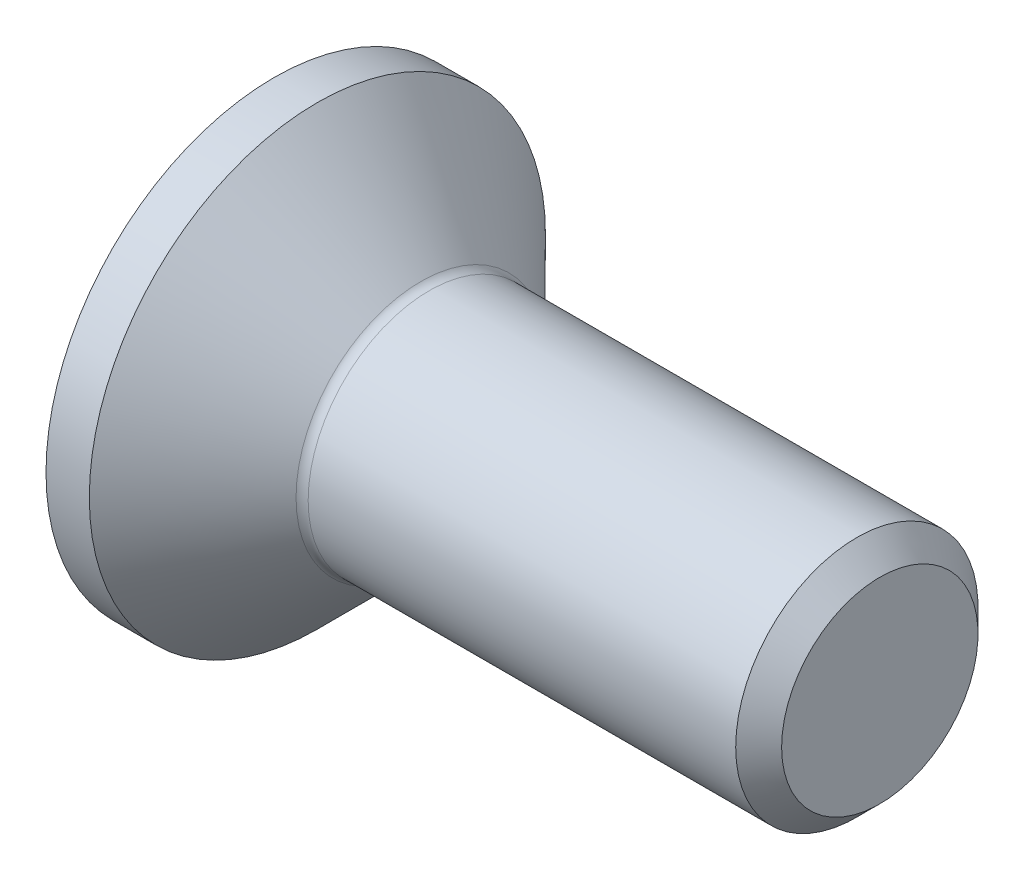
from build123d import *

# Parameters (mm, degrees)
HEXAGONSOCKET_DEPTH = 1.5
HEADFILLET_R        = 0.2
CHAMFER_2_SIZE      = 0.379
SKETCH4_W           = 5
SKETCH4_H           = 5


with BuildPart() as part:
    # Sketch1 → Base (revolve)
    with BuildSketch(Plane.XY):
        Polygon((0, 0), (0, 4.48), (2.48, 2), (10, 2), (10, 0), align=None)
    revolve(axis=Axis((-0.587069181, 0, 0), (1, 0, 0)))

    # Sketch2 → HexagonSocket (cut)
    with BuildSketch(Plane(origin=(0, 0, 0), x_dir=(0, 0, -1), z_dir=(1, 0, 0))):
        Polygon((1.443375673, 0), (0.721687836, 1.25), (-0.721687836, 1.25), (-1.443375673, 0), (-0.721687836, -1.25), (0.721687836, -1.25), align=None)
    extrude(amount=HEXAGONSOCKET_DEPTH, mode=Mode.SUBTRACT)

    # Sketch3 → Cut-Revolve1 (revolve, cut)
    with BuildSketch(Plane.XY):
        Polygon((1.5, 1.25), (2.221687836, 0), (1.5, 0), align=None)
    revolve(axis=Axis((-0.439109555, 0, 0), (1, 0, 0)), mode=Mode.SUBTRACT)

    # HeadFillet
    headfillet_edges = [part.edges().sort_by_distance(p)[0] for p in [
        (2.48, -2, 0),
    ]]
    fillet(headfillet_edges, radius=HEADFILLET_R)

    # Chamfer 2
    chamfer_2_edges = [part.edges().sort_by_distance(p)[0] for p in [
        (10, -2, 0),
    ]]
    chamfer(chamfer_2_edges, length=CHAMFER_2_SIZE)

    # Sketch4 → Cut-Revolve2 (revolve, cut)
    with BuildSketch(Plane(origin=(0, 0, 0), x_dir=(1, 0, 0), z_dir=(0, 1, 0))):
        with Locations((0.5, 6.265)):
            Rectangle(SKETCH4_W, SKETCH4_H)
    revolve(axis=Axis((11.853138686, 0, 0), (-1, 0, 0)), mode=Mode.SUBTRACT)


solid = part.part
